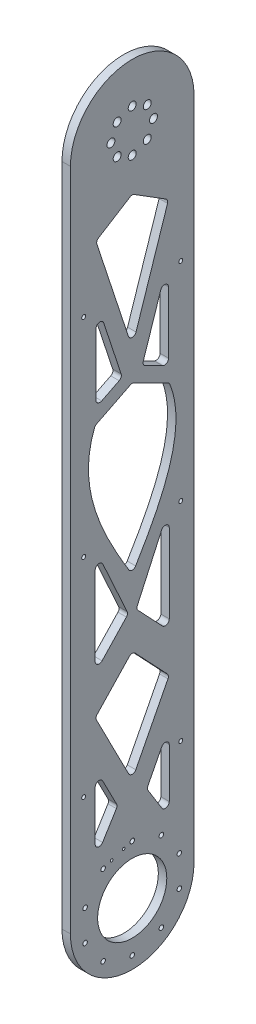
from build123d import *

# Parameters (mm, degrees)
SKETCH1_R           = 3
SKETCH1_R_2         = 1.7
SKETCH1_R_3         = 26
BOSS_EXTRUDE1_DEPTH = 6.35
CUT_EXTRUDE1_DEPTH  = 549.511460682
FILLET1_R           = 3
SKETCH4_R           = 1.5
CUT_EXTRUDE2_DEPTH  = 549.511460792
SKETCH5_R           = 1
CUT_EXTRUDE4_DEPTH  = 549.511460792


with BuildPart() as part:
    # Sketch1 → Boss-Extrude1 (new body)
    with BuildSketch(Plane(origin=(0, 0, 0), x_dir=(0, -1, 0), z_dir=(1, 0, 0))):
        with BuildLine():
            Line((500, 46.5), (0, 46.5))
            ThreePointArc((0, 46.5), (-46.5, 0), (0, -46.5))
            Line((0, -46.5), (500, -46.5))
            ThreePointArc((500, -46.5), (546.5, 0), (500, 46.5))
        make_face()
        with Locations((0, -16)):
            Circle(SKETCH1_R, mode=Mode.SUBTRACT)
        with Locations((-11.313708499, -11.313708499)):
            Circle(SKETCH1_R, mode=Mode.SUBTRACT)
        with Locations((11.313708499, -11.313708499)):
            Circle(SKETCH1_R, mode=Mode.SUBTRACT)
        with Locations((16, 0)):
            Circle(SKETCH1_R, mode=Mode.SUBTRACT)
        with Locations((488.48911696, -35.426855232)):
            Circle(SKETCH1_R_2, mode=Mode.SUBTRACT)
        with Locations((511.51088304, -35.426855232)):
            Circle(SKETCH1_R_2, mode=Mode.SUBTRACT)
        with Locations((469.86411696, -21.895000648)):
            Circle(SKETCH1_R_2, mode=Mode.SUBTRACT)
        with Locations((530.13588304, -21.895000648)):
            Circle(SKETCH1_R_2, mode=Mode.SUBTRACT)
        with Locations((462.75, 0)):
            Circle(SKETCH1_R_2, mode=Mode.SUBTRACT)
        with Locations((-16, 0)):
            Circle(SKETCH1_R, mode=Mode.SUBTRACT)
        with Locations((-11.313708499, 11.313708499)):
            Circle(SKETCH1_R, mode=Mode.SUBTRACT)
        with Locations((11.313708499, 11.313708499)):
            Circle(SKETCH1_R, mode=Mode.SUBTRACT)
        with Locations((0, 16)):
            Circle(SKETCH1_R, mode=Mode.SUBTRACT)
        with Locations((500, 0)):
            Circle(SKETCH1_R_3, mode=Mode.SUBTRACT)
        with Locations((537.25, 0)):
            Circle(SKETCH1_R_2, mode=Mode.SUBTRACT)
        with Locations((469.86411696, 21.895000648)):
            Circle(SKETCH1_R_2, mode=Mode.SUBTRACT)
        with Locations((530.13588304, 21.895000648)):
            Circle(SKETCH1_R_2, mode=Mode.SUBTRACT)
        with Locations((488.48911696, 35.426855232)):
            Circle(SKETCH1_R_2, mode=Mode.SUBTRACT)
        with Locations((511.51088304, 35.426855232)):
            Circle(SKETCH1_R_2, mode=Mode.SUBTRACT)
    extrude(amount=BOSS_EXTRUDE1_DEPTH)

    # Sketch3 → Cut-Extrude1 (cut, through all)
    with BuildSketch(Plane(origin=(6.35, 0, 0), x_dir=(0, 0, -1), z_dir=(1, 0, 0))):
        Polygon((0, -422.848022722), (27.858212922, -368.632839363), (0, -339.139268075), (-27.858212922, -368.632839363), align=None)
        Polygon((0, -41.368651369), (-27.312924288, -58.435222232), (0, -141.248998295), (27.312924288, -58.435222232), align=None)
        Polygon((3, -313.189087212), (27.858212922, -339.506549748), (27.858212922, -258.646044282), align=None)
        Polygon((-27.858212922, -339.506549748), (-27.858212922, -258.646044282), (-3, -313.189087212), align=None)
        Polygon((-27.858212922, -401.452857349), (-11, -434.260816252), (-27.858212922, -461.481824785), align=None)
        Polygon((11, -434.260816252), (27.858212922, -461.481824785), (27.858212922, -401.452857349), align=None)
        with BuildLine():
            Line((0, -164.248853344), (-27.858212922, -178.200474573))
            add(Edge.make_bspline(
                [(-27.858212922, -178.200474573), (-43.7790539, -216.093343216), (-18.61661693, -258.276071598), (0, -289.085024731)],
                knots=[0, 0, 0, 0, 1, 1, 1, 1], degree=3))
            add(Edge.make_bspline(
                [(27.858212922, -178.200474573), (43.7790539, -216.093343216), (18.61661693, -258.276071598), (0, -289.085024731)],
                knots=[0, 0, 0, 0, 1, 1, 1, 1], degree=3))
            Line((27.858212922, -178.200474573), (0, -164.248853344))
        make_face()
        Polygon((7.5, -156.820958214), (27.312924288, -96.747453897), (27.312924288, -166.743432993), align=None)
        Polygon((-27.312924288, -96.747453897), (-27.312924288, -166.743432993), (-7.5, -156.820958214), align=None)
    extrude(amount=-CUT_EXTRUDE1_DEPTH, mode=Mode.SUBTRACT)

    # Fillet1
    fillet1_edges = [part.edges().sort_by_distance(p)[0] for p in [
        (3.175, -58.435222232, -27.312924288),
        (3.175, -41.368651369, 0),
        (3.175, -58.435222232, 27.312924288),
        (3.175, -141.248998295, 0),
        (3.175, -289.085024731, 0),
        (3.175, -164.248853344, 0),
        (3.175, -401.452857349, 27.858212922),
        (3.175, -434.260816252, 11),
        (3.175, -461.481824785, 27.858212922),
        (3.175, -461.481824785, -27.858212922),
        (3.175, -434.260816252, -11),
        (3.175, -401.452857349, -27.858212922),
        (3.175, -368.632839363, -27.858212922),
        (3.175, -339.139268075, 0),
        (3.175, -368.632839363, 27.858212922),
        (3.175, -422.848022722, 0),
        (3.175, -313.189087212, 3),
        (3.175, -339.506549748, 27.858212922),
        (3.175, -258.646044282, 27.858212922),
        (3.175, -178.200474573, -27.858212922),
        (3.175, -178.200474573, 27.858212922),
        (3.175, -339.506549748, -27.858212922),
        (3.175, -313.189087212, -3),
        (3.175, -258.646044282, -27.858212922),
        (3.175, -96.747453897, 27.312924288),
        (3.175, -166.743432993, 27.312924288),
        (3.175, -156.820958214, 7.5),
        (3.175, -166.743432993, -27.312924288),
        (3.175, -156.820958214, -7.5),
        (3.175, -96.747453897, -27.312924288),
    ]]
    fillet(fillet1_edges, radius=FILLET1_R)

    # Sketch4 → Cut-Extrude2 (cut, through all)
    with BuildSketch(Plane(origin=(6.35, 0, 0), x_dir=(0, 0, -1), z_dir=(1, 0, 0))):
        with Locations((-36.5, -103.175)):
            Circle(SKETCH4_R)
        with Locations((36.5, -103.175)):
            Circle(SKETCH4_R)
        with Locations((-36.5, -259.525)):
            Circle(SKETCH4_R)
        with Locations((36.5, -259.525)):
            Circle(SKETCH4_R)
        with Locations((-36.5, -415.875)):
            Circle(SKETCH4_R)
        with Locations((36.5, -415.875)):
            Circle(SKETCH4_R)
    extrude(amount=-CUT_EXTRUDE2_DEPTH, mode=Mode.SUBTRACT)

    # Sketch5 → Cut-Extrude4 (cut, through all)
    with BuildSketch(Plane(origin=(6.35, 0, 0), x_dir=(0, 0, -1), z_dir=(1, 0, 0))):
        with Locations((-6.483486547, -464.674557297)):
            Circle(SKETCH5_R)
        with Locations((-15.518523452, -467.610218743)):
            Circle(SKETCH5_R)
    extrude(amount=-CUT_EXTRUDE4_DEPTH, mode=Mode.SUBTRACT)


solid = part.part
